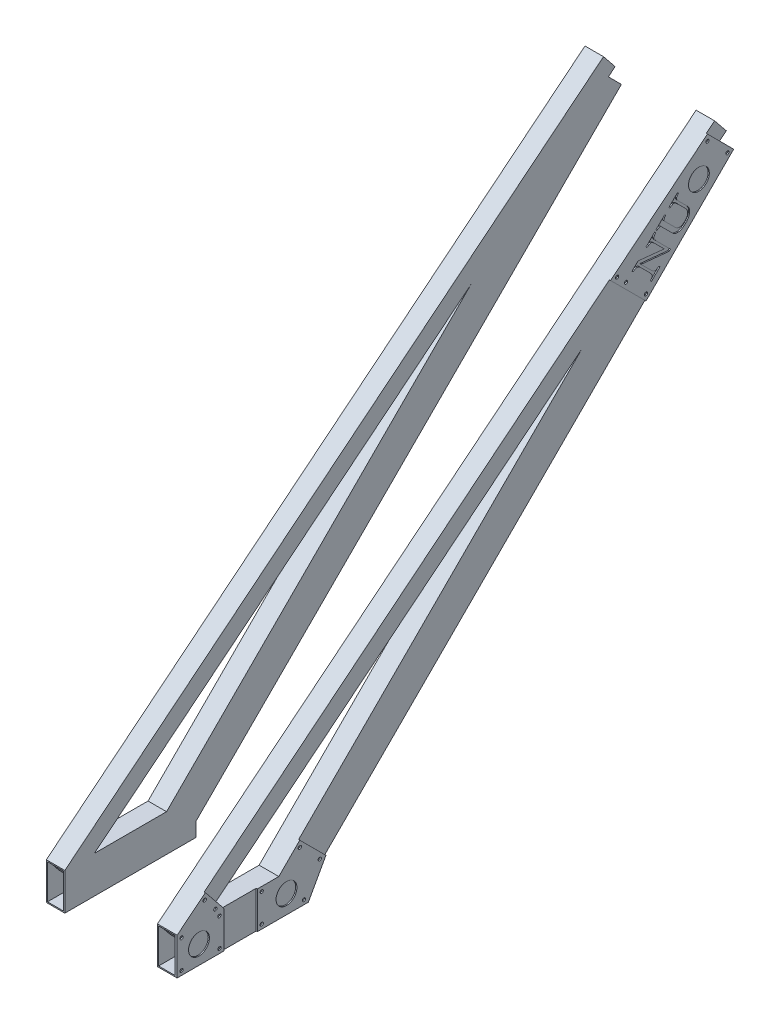
from build123d import *

# Parameters (mm, degrees)
HEEL_GUSSET_EXTRUSION_DEPTH     = 1.5875
SKETCH2_R                       = 14.2875
SKETCH2_R_2                     = 2.25
HEEL_GUSSET_CUT_EXTRUSION_DEPTH = 98
TOE_GUSSET_EXTRUSION_DEPTH      = 1.5875
SKETCH4_R                       = 14.2875
SKETCH4_R_2                     = 2.25
TOE_GUSSET_CUT_EXTRUSION_DEPTH  = 42.5875
KNEE_GUSSET_EXTRUSION_DEPTH     = 1.5875
SKETCH6_R                       = 14.2875
SKETCH6_R_2                     = 2.25
KNEE_GUSSET_CUT_EXTRUSION_DEPTH = 133.5875
BOTTOM_2X1_DEPTH                = 30
BOTTOM_2X1_DEPTH_BACK           = 150
SKETCH7_W                       = 25.4
SKETCH7_H                       = 50.8
SKETCH7_W_2                     = 22.225
SKETCH7_H_2                     = 47.625
TOP_KNEE_SHAFT_W                = 50.8
TOP_KNEE_SHAFT_H                = 25.4
TOP_KNEE_SHAFT_W_2              = 47.625
TOP_KNEE_SHAFT_H_2              = 22.225
BOSS_EXTRUDE2_DEPTH             = 850
SKETCH9_W                       = 25.4
SKETCH9_H                       = 25.4
LEFT_1X1_DEPTH                  = 950
SKETCH10_W                      = 25.4
SKETCH10_H                      = 25.4
BOSS_EXTRUDE4_DEPTH             = 950


with BuildPart() as part:
    # Sketch1 → Heel Gusset Extrusion (new body)
    with BuildSketch(Plane(origin=(88.9, 0, 0), x_dir=(0, 0, -1), z_dir=(1, 0, 0))):
        Polygon((80, -25.4), (150, -25.4), (174.145793616, 18.224769132), (138.224769132, 54.145793616), (109.478975516, 25.4), (80, 25.4), align=None)
    extrude(amount=HEEL_GUSSET_EXTRUSION_DEPTH)

    # Sketch2 → Heel Gusset Cut Extrusion (cut)
    with BuildSketch(Plane(origin=(76.2, 0, 0), x_dir=(0, 0, -1), z_dir=(1, 0, 0))):
        with Locations((120, 0)):
            Circle(SKETCH2_R)
        with Locations((138.224769132, 45.660512242)):
            Circle(SKETCH2_R_2)
        with Locations((165.660512242, 18.224769132)):
            Circle(SKETCH2_R_2)
        with Locations((86, 19.4)):
            Circle(SKETCH2_R_2)
        with Locations((86, -19.4)):
            Circle(SKETCH2_R_2)
        with Locations((144, -19.4)):
            Circle(SKETCH2_R_2)
    extrude(amount=HEEL_GUSSET_CUT_EXTRUSION_DEPTH, mode=Mode.SUBTRACT)



with BuildPart() as body_2:
    # Sketch3 → Toe Gusset Extrusion (new body)
    with BuildSketch(Plane(origin=(88.9, 0, 0), x_dir=(0, 0, -1), z_dir=(1, 0, 0))):
        Polygon((8.710787264, 56.688421729), (-30, 25.4), (-30, -25.4), (34, -25.4), (34, 25.4), align=None)
    extrude(amount=TOE_GUSSET_EXTRUSION_DEPTH)

    # Sketch4 → Toe Gusset Cut Extrusion (cut)
    with BuildSketch(Plane(origin=(76.2, 0, 0), x_dir=(0, 0, -1), z_dir=(1, 0, 0))):
        Circle(SKETCH4_R)
        with Locations((28, 19.4)):
            Circle(SKETCH4_R_2)
        with Locations((28, -19.4)):
            Circle(SKETCH4_R_2)
        with Locations((22.42887895, 30.171120686)):
            Circle(SKETCH4_R_2)
        with Locations((7.816066327, 48.250443627)):
            Circle(SKETCH4_R_2)
        with Locations((-24, -19.4)):
            Circle(SKETCH4_R_2)
        with Locations((-24, 19.4)):
            Circle(SKETCH4_R_2)
    extrude(amount=TOE_GUSSET_CUT_EXTRUSION_DEPTH, mode=Mode.SUBTRACT)


with BuildPart() as body_3:
    # Sketch5 → Knee Gusset Extrusion (new body)
    with BuildSketch(Plane(origin=(88.9, 0, 0), x_dir=(0, 0, -1), z_dir=(1, 0, 0))):
        Polygon((697.442069995, 613.363094479), (733.363094479, 577.442069995), (613.154941677, 457.233917193), (577.233917193, 493.154941677), (564.487646725, 505.901212145), align=None)
    extrude(amount=KNEE_GUSSET_EXTRUSION_DEPTH)

    # Sketch6 → Knee Gusset Cut Extrusion (cut)
    with BuildSketch(Plane(origin=(76.2, 0, 0), x_dir=(0, 0, -1), z_dir=(1, 0, 0))):
        with Locations((685.685424949, 565.685424949)):
            Circle(SKETCH6_R)
        with Locations((697.442069995, 604.877813105)):
            Circle(SKETCH6_R_2)
        with Locations((724.877813105, 577.442069995)):
            Circle(SKETCH6_R_2)
        with Locations((613.154941677, 465.719198567)):
            Circle(SKETCH6_R_2)
        with Locations((585.719198567, 493.154941677)):
            Circle(SKETCH6_R_2)
        with Locations((573.446580696, 505.427559549)):
            Circle(SKETCH6_R_2)
        with BuildLine():
            add(Edge.make_bspline(
                [(626.283784571, 531.747742034), (626.18476912, 531.633237155), (625.962022179, 531.375644922), (625.626237185, 530.918834739), (625.25138938, 530.3504036), (624.838610258, 529.714861229), (624.445802904, 529.065306723), (624.133069792, 528.459297066), (623.878562556, 527.946916437), (623.777618917, 527.617447402), (623.732326238, 527.469617034)],
                knots=[0, 0, 0, 0, 0.725463405, 1.632015524, 2.714952311, 3.989355048, 5.26524501, 6.350630696, 7.25993995, 8, 8, 8, 8], degree=3))
            add(Edge.make_bspline(
                [(623.732326238, 527.469617034), (623.703530931, 527.264134905), (623.643492561, 526.835703552), (623.772177185, 526.1529637), (624.061557775, 525.437957682), (624.512217524, 524.683291323), (625.105457958, 523.886348598), (625.819968772, 523.035442476), (626.634543073, 522.112536965), (627.2389781, 521.500356546), (627.555659571, 521.179617034)],
                knots=[0, 0, 0, 0, 0.650688799, 1.356689678, 2.157172564, 3.075778814, 4.119480805, 5.287640336, 6.578914174, 8, 8, 8, 8], degree=3))
            Line((627.555659571, 521.179617034), (646.572117904, 502.1631587))
            Line((646.572117904, 502.1631587), (644.806909571, 500.397950367))
            Line((644.806909571, 500.397950367), (606.157326238, 504.252117034))
            Line((606.157326238, 504.252117034), (619.554409571, 490.8550337))
            add(Edge.make_bspline(
                [(619.554409571, 490.8550337), (619.910944108, 490.504768306), (620.580485438, 489.846999888), (621.570347843, 488.971663238), (622.463641293, 488.258819131), (623.279272779, 487.711943052), (624.025892905, 487.310770024), (624.728888336, 487.066437289), (625.383198663, 486.909879006), (625.805202574, 486.934958494), (626.006284571, 486.9469087)],
                knots=[0, 0, 0, 0, 1.546081858, 2.903409339, 4.086612414, 5.078779751, 5.939243736, 6.698582645, 7.379883472, 8, 8, 8, 8], degree=3))
            add(Edge.make_bspline(
                [(626.006284571, 486.9469087), (626.172119348, 486.972278101), (626.552278043, 487.030434772), (627.164889568, 487.277190829), (627.890210481, 487.640981197), (628.683214639, 488.105159548), (629.448742054, 488.592212392), (630.103116655, 489.024749487), (630.605103235, 489.36074646), (630.863967709, 489.583875069), (630.970451238, 489.6756587)],
                knots=[0, 0, 0, 0, 0.70275794, 1.610998294, 2.754903516, 4.113646974, 5.467022005, 6.565581722, 7.409954109, 8, 8, 8, 8], degree=3))
            Line((630.970451238, 489.6756587), (632.273159571, 488.372950367))
            Line((632.273159571, 488.372950367), (620.494826238, 476.594617034))
            Line((620.494826238, 476.594617034), (619.192117904, 477.897325367))
            add(Edge.make_bspline(
                [(619.192117904, 477.897325367), (619.288579824, 478.014451556), (619.511548256, 478.28518474), (619.851268754, 478.772555951), (620.256060932, 479.384493084), (620.678952211, 480.090094675), (621.088170756, 480.787453187), (621.409889622, 481.399151004), (621.625002645, 481.881928832), (621.69265312, 482.171916948), (621.720451238, 482.291075367)],
                knots=[0, 0, 0, 0, 0.714187218, 1.650819347, 2.795016477, 4.168543286, 5.523564251, 6.600347029, 7.424871484, 8, 8, 8, 8], degree=3))
            add(Edge.make_bspline(
                [(621.720451238, 482.291075367), (621.741833669, 482.496564716), (621.785021988, 482.911612904), (621.690597888, 483.55247132), (621.466415779, 484.194261462), (621.189124324, 484.734590612), (620.892084919, 485.186198357), (620.619240177, 485.580203078), (620.273789022, 485.998332413), (619.8904193, 486.467038485), (619.438148063, 486.964122571), (618.942772007, 487.511567431), (618.384169234, 488.08910677), (617.992629789, 488.483882195), (617.789201238, 488.688992034)],
                knots=[0, 0, 0, 0, 0.954113466, 1.927122102, 2.969790135, 4.093050465, 4.730288298, 5.473356475, 6.311750304, 7.241419362, 8.278364396, 9.424166478, 10.661697852, 12, 12, 12, 12], degree=3))
            Line((617.789201238, 488.688992034), (604.993367904, 501.484825367))
            add(Edge.make_bspline(
                [(604.993367904, 501.484825367), (604.697575712, 501.752960135), (604.09479709, 502.299377214), (603.184612924, 502.768850142), (602.435185964, 503.073004975), (601.878433987, 503.219279888), (601.339072884, 503.297183214), (600.987782575, 503.28106551), (600.815451238, 503.2731587)],
                knots=[0, 0, 0, 0, 1.532670844, 3.123345518, 3.910287659, 4.647577312, 5.336546431, 6, 6, 6, 6], degree=3))
            add(Edge.make_bspline(
                [(600.815451238, 503.2731587), (600.586021548, 503.24140033), (600.109537339, 503.175443907), (599.374402357, 502.98570074), (598.603379871, 502.6939537), (597.810218946, 502.344418989), (597.057509928, 501.949300207), (596.374077537, 501.573901785), (595.807719035, 501.186496471), (595.479615017, 500.916544436), (595.327117904, 500.791075367)],
                knots=[0, 0, 0, 0, 0.911473382, 1.892966314, 2.981176775, 4.154254047, 5.303532387, 6.327487696, 7.222645008, 8, 8, 8, 8], degree=3))
            Line((595.327117904, 500.791075367), (594.032117904, 502.086075367))
            Line((594.032117904, 502.086075367), (602.226076238, 510.2800337))
            Line((602.226076238, 510.2800337), (638.185451238, 506.618575367))
            Line((638.185451238, 506.618575367), (625.821284571, 518.982742034))
            add(Edge.make_bspline(
                [(625.821284571, 518.982742034), (625.461895262, 519.335217253), (624.786680767, 519.997441676), (623.7949158, 520.882691191), (622.885386847, 521.588528501), (622.063135354, 522.132113101), (621.316243132, 522.521343355), (620.640758318, 522.763520475), (620.025472579, 522.899846132), (619.642006809, 522.85177656), (619.461909571, 522.829200367)],
                knots=[0, 0, 0, 0, 1.578073432, 2.964857417, 4.165232815, 5.184084504, 6.052322309, 6.796310792, 7.434679395, 8, 8, 8, 8], degree=3))
            add(Edge.make_bspline(
                [(619.461909571, 522.829200367), (619.293676074, 522.781282462), (618.921451551, 522.675261843), (618.335464638, 522.415611689), (617.658016348, 522.078000252), (616.931306312, 521.658032526), (616.20980238, 521.23065472), (615.574642153, 520.810271897), (615.048873274, 520.439265249), (614.748279866, 520.189448025), (614.613367904, 520.077325367)],
                knots=[0, 0, 0, 0, 0.748119284, 1.655249091, 2.737561554, 3.988776058, 5.247127191, 6.327201157, 7.249216494, 8, 8, 8, 8], degree=3))
            Line((614.613367904, 520.077325367), (613.318367904, 521.372325367))
            Line((613.318367904, 521.372325367), (624.988784571, 533.042742034))
            Line((624.988784571, 533.042742034), (626.283784571, 531.747742034))
        make_face()
        with BuildLine():
            add(Edge.make_bspline(
                [(657.604206668, 563.06816413), (657.50531789, 562.95614133), (657.287679711, 562.709597296), (656.957871575, 562.277155871), (656.573569787, 561.766130042), (656.164443972, 561.184754329), (655.762527124, 560.577822143), (655.432867225, 559.96462283), (655.16055493, 559.384325585), (655.045723456, 558.992095743), (654.991081668, 558.805455797)],
                knots=[0, 0, 0, 0, 0.711799156, 1.566554612, 2.5900989, 3.758614379, 4.954016207, 6.055234405, 7.074596302, 8, 8, 8, 8], degree=3))
            add(Edge.make_bspline(
                [(654.991081668, 558.805455797), (654.96484205, 558.610024253), (654.909572125, 558.19837623), (655.052980316, 557.536779742), (655.335787264, 556.825698028), (655.786950678, 556.067755175), (656.366388192, 555.264041275), (657.06697606, 554.423712496), (657.84957553, 553.520655104), (658.4330684, 552.930900777), (658.737331668, 552.623372464)],
                knots=[0, 0, 0, 0, 0.630343996, 1.327727625, 2.14457276, 3.089112149, 4.15600778, 5.331150197, 6.608324105, 8, 8, 8, 8], degree=3))
            Line((658.737331668, 552.623372464), (670.030040001, 541.33066413))
            add(Edge.make_bspline(
                [(670.030040001, 541.33066413), (670.369318192, 540.96931117), (671.028026828, 540.267744366), (671.823561608, 539.09279456), (672.424104651, 537.867997864), (672.826560094, 536.593197023), (673.043693678, 535.292700501), (673.12099097, 533.982796135), (673.059625407, 532.661685782), (672.890427522, 531.793978531), (672.805040001, 531.356080797)],
                knots=[0, 0, 0, 0, 1.096769787, 2.129378636, 3.12993495, 4.109328749, 5.079831248, 6.043565211, 7.012664283, 8, 8, 8, 8], degree=3))
            add(Edge.make_bspline(
                [(672.805040001, 531.356080797), (672.696846894, 530.93243771), (672.480978173, 530.087177845), (672.026488277, 528.866246477), (671.496105905, 527.686080269), (670.869945043, 526.568212466), (670.185042906, 525.508582704), (669.461524671, 524.515598073), (668.70664255, 523.589689568), (668.163377651, 523.025006063), (667.894831668, 522.745872464)],
                knots=[0, 0, 0, 0, 1.045021202, 2.085044008, 3.110809235, 4.136795311, 5.145859193, 6.1266866, 7.07398621, 8, 8, 8, 8], degree=3))
            add(Edge.make_bspline(
                [(667.894831668, 522.745872464), (667.468284097, 522.334305853), (666.635846489, 521.531104644), (665.333015279, 520.450032097), (664.019171309, 519.51845916), (662.70055901, 518.741921935), (661.397527492, 518.097389039), (660.116016587, 517.594798831), (658.860350755, 517.220500568), (658.022248879, 517.079772696), (657.611915001, 517.010872464)],
                knots=[0, 0, 0, 0, 1.187406935, 2.31730821, 3.388671346, 4.411192297, 5.38058751, 6.298447692, 7.166921615, 8, 8, 8, 8], degree=3))
            add(Edge.make_bspline(
                [(657.611915001, 517.010872464), (657.219235568, 516.967471725), (656.453047658, 516.882789111), (655.315848306, 516.926295468), (654.222668585, 517.054023136), (653.179774733, 517.327042347), (652.201161077, 517.716529744), (651.281773794, 518.191436555), (650.44213167, 518.784340762), (649.939932651, 519.245808459), (649.687748334, 519.47753913)],
                knots=[0, 0, 0, 0, 1.100464238, 2.147202838, 3.165915912, 4.165414661, 5.143591158, 6.098895442, 7.04534112, 8, 8, 8, 8], degree=3))
            Line((649.687748334, 519.47753913), (634.325040001, 534.840247464))
            add(Edge.make_bspline(
                [(634.325040001, 534.840247464), (634.118566726, 535.030626141), (633.732735922, 535.386381423), (633.137197967, 535.655493606), (632.645732603, 535.760153917), (632.230780504, 535.739145074), (631.76690786, 535.673081136), (631.448825208, 535.577137282), (631.280248334, 535.52628913)],
                knots=[0, 0, 0, 0, 1.50945907, 2.820683726, 3.471536488, 4.207609481, 5.050072085, 6, 6, 6, 6], degree=3))
            add(Edge.make_bspline(
                [(631.280248334, 535.52628913), (631.009138049, 535.421102816), (630.410698484, 535.188918144), (629.577345515, 534.654672961), (628.778437485, 534.105561968), (628.295341668, 533.71728603), (628.081290001, 533.545247464)],
                knots=[0, 0, 0, 0, 0.921147977, 2.033310521, 3.128592823, 4, 4, 4, 4], degree=3))
            Line((628.081290001, 533.545247464), (626.786290001, 534.840247464))
            Line((626.786290001, 534.840247464), (638.749623334, 546.803580797))
            Line((638.749623334, 546.803580797), (640.044623334, 545.508580797))
            add(Edge.make_bspline(
                [(640.044623334, 545.508580797), (639.948601488, 545.401478082), (639.746482039, 545.176034157), (639.443486618, 544.79818828), (639.116140443, 544.37230261), (638.781358493, 543.912574479), (638.472748493, 543.455220421), (638.188701804, 543.051637111), (637.975409847, 542.694432153), (637.850081138, 542.476763087), (637.793790001, 542.378997464)],
                knots=[0, 0, 0, 0, 0.893916814, 1.881634042, 3.009219562, 4.232705447, 5.415488858, 6.438719388, 7.298753957, 8, 8, 8, 8], degree=3))
            add(Edge.make_bspline(
                [(637.793790001, 542.378997464), (637.727421803, 542.231808143), (637.601297901, 541.952094483), (637.492704708, 541.519331916), (637.491103785, 541.101031571), (637.623553615, 540.582558215), (637.945547822, 539.982659426), (638.304096068, 539.579179684), (638.487540001, 539.372747464)],
                knots=[0, 0, 0, 0, 0.86893304, 1.651291271, 2.384983755, 3.096801689, 4.51463751, 6, 6, 6, 6], degree=3))
            Line((638.487540001, 539.372747464), (652.840456668, 525.019830797))
            add(Edge.make_bspline(
                [(652.840456668, 525.019830797), (653.211329525, 524.675284098), (653.975232967, 523.965605822), (655.051519181, 523.195928969), (656.002045427, 522.662736645), (656.768833306, 522.337625674), (657.578299893, 522.094563745), (658.137365211, 521.999959489), (658.421290001, 521.95191413)],
                knots=[0, 0, 0, 0, 1.404697551, 2.893318494, 3.659687318, 4.426885815, 5.201084203, 6, 6, 6, 6], degree=3))
            add(Edge.make_bspline(
                [(658.421290001, 521.95191413), (658.724297017, 521.929363902), (659.338291214, 521.883669551), (660.27971707, 521.948097581), (661.240373666, 522.144322279), (662.244929352, 522.43072874), (663.285922136, 522.90540146), (664.355643416, 523.588751999), (665.473322891, 524.46979357), (666.194771348, 525.162082534), (666.576706668, 525.528580797)],
                knots=[0, 0, 0, 0, 0.788940443, 1.598658875, 2.442011267, 3.333575882, 4.30784546, 5.402802075, 6.625041594, 8, 8, 8, 8], degree=3))
            add(Edge.make_bspline(
                [(666.576706668, 525.528580797), (666.92473688, 525.892979728), (667.595260553, 526.595039781), (668.460789216, 527.696970427), (669.159166734, 528.789355406), (669.678889458, 529.877158201), (670.04875982, 530.942015001), (670.293559435, 531.97717286), (670.412048717, 532.985432268), (670.378140887, 533.645320961), (670.361498334, 533.969205797)],
                knots=[0, 0, 0, 0, 1.265613172, 2.438361849, 3.51490655, 4.516988949, 5.460338496, 6.342064128, 7.186256265, 8, 8, 8, 8], degree=3))
            add(Edge.make_bspline(
                [(670.361498334, 533.969205797), (670.327900838, 534.262842538), (670.261691037, 534.841505604), (670.079647764, 535.679984776), (669.812224527, 536.468280358), (669.479815043, 537.206513013), (669.092739991, 537.905349991), (668.652040452, 538.556300537), (668.174275029, 539.175684745), (667.813706722, 539.548123381), (667.632748334, 539.73503913)],
                knots=[0, 0, 0, 0, 1.088265488, 2.144619379, 3.153255501, 4.148840658, 5.123281855, 6.091914249, 7.042389155, 8, 8, 8, 8], degree=3))
            Line((667.632748334, 539.73503913), (656.979831668, 550.387955797))
            add(Edge.make_bspline(
                [(656.979831668, 550.387955797), (656.650876725, 550.706634263), (656.025039162, 551.312920803), (655.09046129, 552.139637781), (654.201083114, 552.823677892), (653.369200819, 553.37755849), (652.601500317, 553.791548417), (651.903361149, 554.06578063), (651.263182608, 554.196003443), (650.867236714, 554.148640621), (650.682123334, 554.126497464)],
                knots=[0, 0, 0, 0, 1.457529613, 2.772953556, 3.968543238, 5.025438667, 5.950917291, 6.737637765, 7.409818002, 8, 8, 8, 8], degree=3))
            add(Edge.make_bspline(
                [(650.682123334, 554.126497464), (650.480066307, 554.074916569), (650.054384251, 553.966248923), (649.414655569, 553.689764595), (648.727515288, 553.348124923), (648.037813866, 552.913018091), (647.376713829, 552.469593235), (646.780176881, 552.060544709), (646.291953696, 551.686172834), (646.002504925, 551.444804607), (645.872123334, 551.336080797)],
                knots=[0, 0, 0, 0, 0.891762213, 1.878713045, 2.976092237, 4.17633605, 5.366551064, 6.386087247, 7.273016394, 8, 8, 8, 8], degree=3))
            Line((645.872123334, 551.336080797), (644.577123334, 552.631080797))
            Line((644.577123334, 552.631080797), (656.309206668, 564.36316413))
            Line((656.309206668, 564.36316413), (657.604206668, 563.06816413))
        make_face()
    extrude(amount=KNEE_GUSSET_CUT_EXTRUSION_DEPTH, mode=Mode.SUBTRACT)


with BuildPart() as part_1:
    add(part.part)

    add(body_2.part)  # Bottom 2x1 merges body 2
    # Sketch7 → Bottom 2x1 (add, two sides: drawn at the far end of the back side and taken through both)
    # profile 1 of 2: a face of its own
    with BuildSketch(Plane.XY.offset(-BOTTOM_2X1_DEPTH_BACK)):
        with Locations((-76.2, 0)):
            Rectangle(SKETCH7_W, SKETCH7_H)
        with Locations((-76.2, 0)):
            Rectangle(SKETCH7_W_2, SKETCH7_H_2, mode=Mode.SUBTRACT)
    # profile 2 of 2: a face of its own
    with BuildSketch(Plane.XY.offset(-BOTTOM_2X1_DEPTH_BACK)):
        with Locations((76.2, 0)):
            Rectangle(SKETCH7_W, SKETCH7_H)
        with Locations((76.2, 0)):
            Rectangle(SKETCH7_W_2, SKETCH7_H_2, mode=Mode.SUBTRACT)
    extrude(amount=BOTTOM_2X1_DEPTH + BOTTOM_2X1_DEPTH_BACK)


    add(body_3.part)  # Boss-Extrude2 merges body 3
    # Top Knee Shaft → Boss-Extrude2 (add)
    # profile 1 of 2: a face of its own
    with BuildSketch(Plane(origin=(0, 655.402582237, -655.402582237), x_dir=(0, -0.7071067811865508, -0.7071067811865442), z_dir=(0, 0.7071067811865442, -0.7071067811865508))):
        with Locations((84.852813742, 76.2)):
            Rectangle(TOP_KNEE_SHAFT_W, TOP_KNEE_SHAFT_H)
        with Locations((84.852813742, 76.2)):
            Rectangle(TOP_KNEE_SHAFT_W_2, TOP_KNEE_SHAFT_H_2, mode=Mode.SUBTRACT)
    # profile 2 of 2: a face of its own
    with BuildSketch(Plane(origin=(0, 655.402582237, -655.402582237), x_dir=(0, -0.7071067811865508, -0.7071067811865442), z_dir=(0, 0.7071067811865442, -0.7071067811865508))):
        with Locations((84.852813742, -76.2)):
            Rectangle(TOP_KNEE_SHAFT_W, TOP_KNEE_SHAFT_H)
        with Locations((84.852813742, -76.2)):
            Rectangle(TOP_KNEE_SHAFT_W_2, TOP_KNEE_SHAFT_H_2, mode=Mode.SUBTRACT)
    extrude(amount=-BOSS_EXTRUDE2_DEPTH)

    # Sketch9 → Left 1x1 (add)
    with BuildSketch(Plane(origin=(-76.2, 25.4, 30), x_dir=(1, 0, 0), z_dir=(0, -0.628604763742392, 0.7777249198787266))):
        with Locations((0, -12.7)):
            Rectangle(SKETCH9_W, SKETCH9_H)
    extrude(amount=-LEFT_1X1_DEPTH)

    # Sketch10 → Boss-Extrude4 (add)
    with BuildSketch(Plane(origin=(-76.2, 25.4, 30), x_dir=(1, 0, 0), z_dir=(0, -0.628604763742392, 0.7777249198787266))):
        with Locations((152.4, -12.7)):
            Rectangle(SKETCH10_W, SKETCH10_H)
    extrude(amount=-BOSS_EXTRUDE4_DEPTH)


solid = part_1.part
